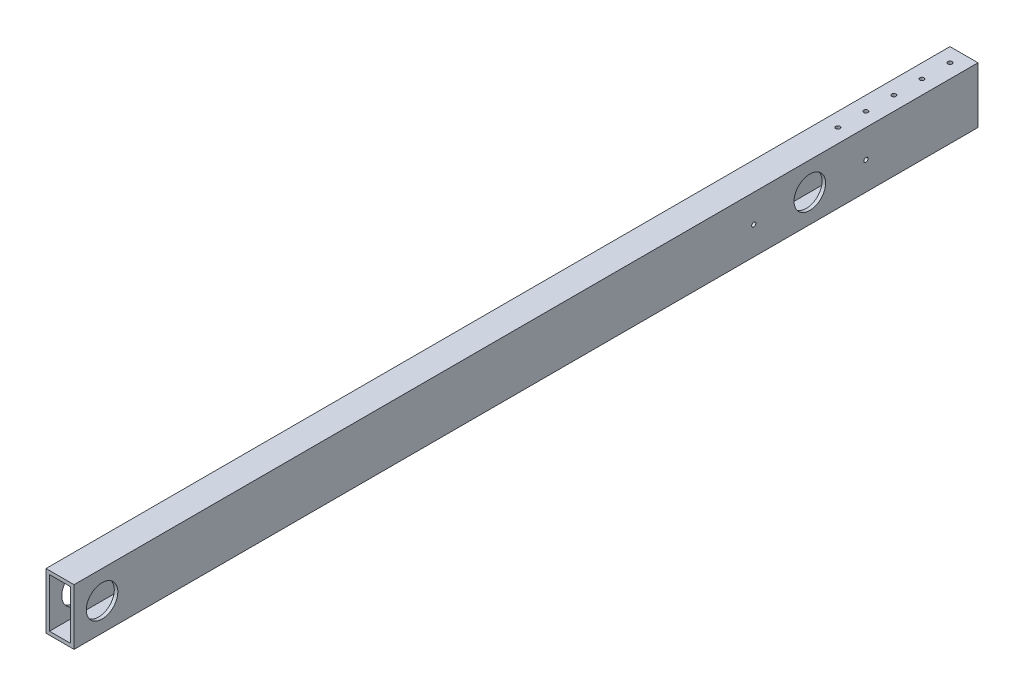
from build123d import *

# Parameters (mm, degrees)
SKETCH1_W           = 25.4
SKETCH1_H           = 50.8
SKETCH1_W_2         = 19.05
SKETCH1_H_2         = 44.45
BOSS_EXTRUDE1_DEPTH = 409.575
SKETCH7_R           = 1.905
CUT_EXTRUDE1_DEPTH  = 413.908719483
SKETCH8_R           = 1.905
SKETCH8_R_2         = 14.2875
CUT_EXTRUDE2_DEPTH  = 412.147176355


with BuildPart() as part:
    # Sketch1 → Boss-Extrude1 (new, symmetric)
    with BuildSketch(Plane.XY):
        Rectangle(SKETCH1_W, SKETCH1_H)
        Rectangle(SKETCH1_W_2, SKETCH1_H_2, mode=Mode.SUBTRACT)
    extrude(amount=BOSS_EXTRUDE1_DEPTH, both=True)

    # Sketch7 → Cut-Extrude1 (cut, through all)
    with BuildSketch(Plane(origin=(0, 25.4, 0), x_dir=(1, 0, 0), z_dir=(0, 1, 0))):
        with Locations((0, 396.875)):
            Circle(SKETCH7_R)
        with Locations((0, 371.475)):
            Circle(SKETCH7_R)
        with Locations((0, 346.075)):
            Circle(SKETCH7_R)
        with Locations((0, 320.675)):
            Circle(SKETCH7_R)
        with Locations((0, 295.275)):
            Circle(SKETCH7_R)
    extrude(amount=-CUT_EXTRUDE1_DEPTH, mode=Mode.SUBTRACT)

    # Sketch8 → Cut-Extrude2 (cut, through all)
    with BuildSketch(Plane(origin=(12.7, 0, 0), x_dir=(0, 0, -1), z_dir=(1, 0, 0))):
        with Locations((206.375, 0)):
            Circle(SKETCH8_R)
        with Locations((307.975, 0)):
            Circle(SKETCH8_R)
        with Locations((257.175, 0)):
            Circle(SKETCH8_R_2)
        with Locations((-384.175, 0)):
            Circle(SKETCH8_R_2)
    extrude(amount=-CUT_EXTRUDE2_DEPTH, mode=Mode.SUBTRACT)


solid = part.part
